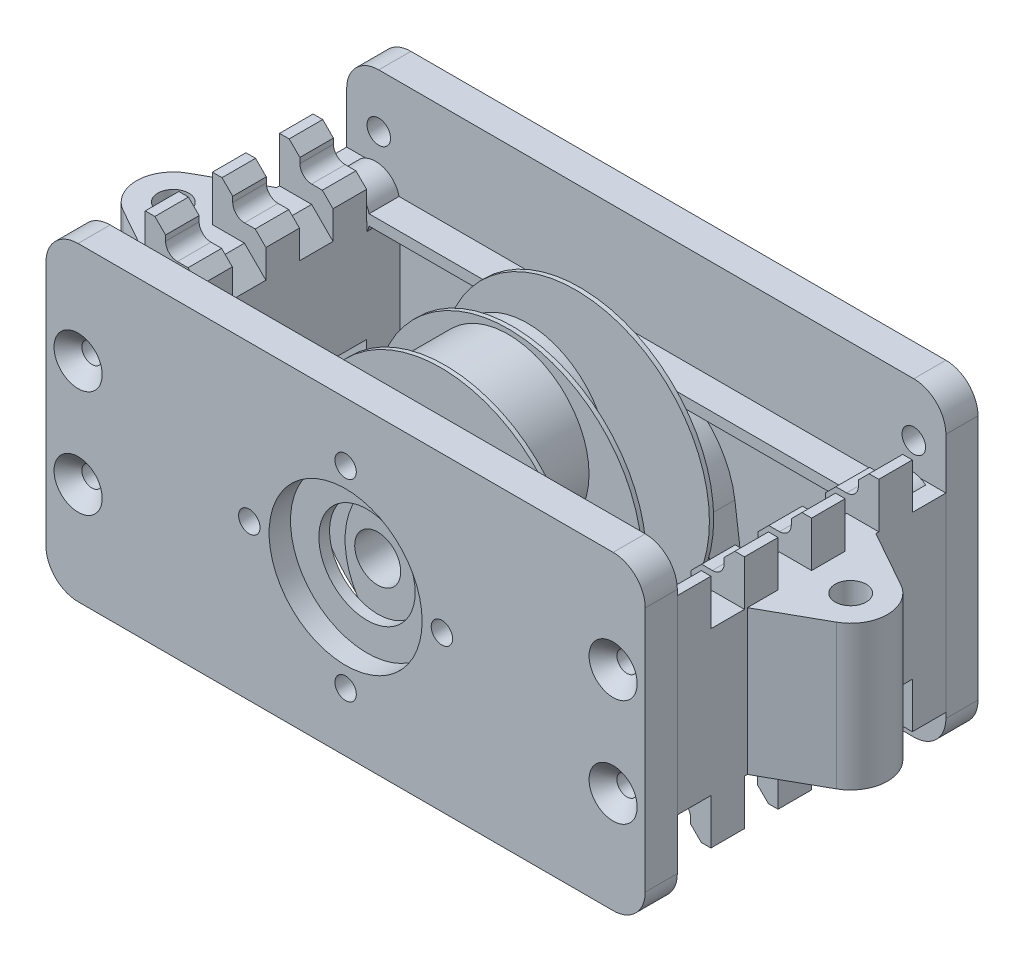
from build123d import *
from build123d.topology import SkipClean

# Parameters (mm, degrees)
SKETCH3_R                        = 8.65
SKETCH3_R_2                      = 7.65
SKETCH3_R_3                      = 2.25
SKETCH3_R_4                      = 1.25
BOSS_EXTRUDE1_DEPTH              = 2.8
BOSS_EXTRUDE2_DEPTH              = 2
BOSS_EXTRUDE3_DEPTH              = 3
BOSS_EXTRUDE4_START              = 2
BOSS_EXTRUDE4_DEPTH              = 1
FILLET1_R                        = 1
SKETCH4_R                        = 2
CUT_EXTRUDE1_DEPTH               = 36.881541288
CIRPATTERN1_COUNT                = 4
CIRPATTERN1_ANGLE                = 23
CIRPATTERN1_THE_OTHER_WAY_COUNT  = 4
CIRPATTERN1_THE_OTHER_WAY_ANGLE  = 23
BOSS_EXTRUDE5_START              = -0.3
SKETCH5_W                        = 56
SKETCH5_H                        = 29
SKETCH5_R                        = 1.1
SKETCH5_R_2                      = 0.95
BOSS_EXTRUDE5_DEPTH              = 3
BOSS_EXTRUDE6_START              = -3.3
SKETCH5_2_R                      = 1.1
BOSS_EXTRUDE6_DEPTH              = 0.8
BOSS_EXTRUDE7_OUTLINE_R          = 7.55
BOSS_EXTRUDE7_DEPTH              = 5.9
BOSS_EXTRUDE8_START              = 5.9
SKETCH6_4_R                      = 12.5
SKETCH6_4_R_2                    = 2.15
BOSS_EXTRUDE8_DEPTH              = 0.4
BOSS_EXTRUDE9_START              = 6.3
BOSS_EXTRUDE9_OUTLINE_R          = 7.55
BOSS_EXTRUDE9_DEPTH              = 5.9
BOSS_EXTRUDE10_START             = 12.2
SKETCH6_6_R                      = 12.5
SKETCH6_6_R_2                    = 2.15
BOSS_EXTRUDE10_DEPTH             = 0.4
BOSS_EXTRUDE11_START             = 12.6
BOSS_EXTRUDE11_OUTLINE_R         = 7.55
BOSS_EXTRUDE11_DEPTH             = 5.9
BOSS_EXTRUDE12_START             = 18.5
SKETCH6_8_R                      = 12.5
SKETCH6_8_R_2                    = 2.15
BOSS_EXTRUDE12_DEPTH             = 0.4
BOSS_EXTRUDE13_START             = 18.9
BOSS_EXTRUDE13_OUTLINE_R         = 7.55
BOSS_EXTRUDE13_DEPTH             = 5.9
SKETCH7_W                        = 3.1375
SKETCH7_H                        = 13.5
SKETCH7_H_2                      = 4.25
BOSS_EXTRUDE14_DEPTH             = 5
BOSS_EXTRUDE15_REACH             = 47.714
SKETCH8_R                        = 1.45
BOSS_EXTRUDE15_DIRECTION_2_REACH = 47.714
CUT_EXTRUDE3_DEPTH               = 51.375998652
CUT_EXTRUDE8_DEPTH               = 51.375998652
CUT_EXTRUDE8_DEPTH_BACK          = 51.375998652
SKETCH5_4_R                      = 0.95
CHAMFER1_SIZE                    = 2
CHAMFER2_SIZE                    = 1
SKETCH10_3_R                     = 4.5
SKETCH10_3_R_2                   = 1
CUT_EXTRUDE5_DEPTH               = 3
CHAMFER3_SIZE                    = 1.3
SKETCH10_R                       = 7.15
SKETCH10_R_2                     = 4.5
CUT_EXTRUDE4_DEPTH               = 2
CUT_EXTRUDE6_START               = -31.1
SKETCH10_4_R                     = 4.5
CUT_EXTRUDE6_DEPTH               = 6.3
CHAMFER4_SIZE                    = 1.3
CHAMFER5_SIZE                    = 1.3
SKETCH11_R                       = 2.15
CUT_EXTRUDE7_DEPTH               = 3
FILLET2_R                        = 3
FILLET3_R                        = 3


with BuildPart() as part:
    # Sketch3 → Boss-Extrude1 (new body)
    # profile 1 of 6: a face of its own
    with BuildSketch(Plane.XY):
        with Locations((0, -4.5)):
            Circle(SKETCH3_R)
        with Locations((0, -4.5)):
            Circle(SKETCH3_R_2, mode=Mode.SUBTRACT)
    # profile 2 of 6: a face of its own
    with BuildSketch(Plane.XY):
        with BuildLine():
            Line((1, 4.5), (-1, 4.5))
            Line((-1, 4.5), (-1, 4.092002095))
            ThreePointArc((-1, 4.092002095), (0, 4.15), (1, 4.092002095))
            Line((1, 4.092002095), (1, 4.5))
        make_face()
    # profile 3 of 6: a face of its own
    with BuildSketch(Plane.XY):
        with BuildLine():
            Line((22.806258903, 5.5), (-22.806258903, 5.5))
            ThreePointArc((-22.806258903, 5.5), (-22.764108962, 5.251577555), (-22.75, 5))
            ThreePointArc((-22.75, 5), (-22.764108962, 4.748422445), (-22.806258903, 4.5))
            Line((-22.806258903, 4.5), (-1, 4.5))
            Line((-1, 4.5), (1, 4.5))
            Line((1, 4.5), (22.806258903, 4.5))
            ThreePointArc((22.806258903, 4.5), (22.75, 5), (22.806258903, 5.5))
        make_face()
    # profile 4 of 6: a face of its own
    with BuildSketch(Plane.XY):
        with Locations((25, 5)):
            Circle(SKETCH3_R_3)
        with Locations((25, 5)):
            Circle(SKETCH3_R_4, mode=Mode.SUBTRACT)
    # profile 5 of 6: a face of its own
    with BuildSketch(Plane.XY):
        with Locations((-25, 5)):
            Circle(SKETCH3_R_3)
        with Locations((-25, 5)):
            Circle(SKETCH3_R_4, mode=Mode.SUBTRACT)
    # profile 6 of 6: a face of its own
    with BuildSketch(Plane.XY):
        with BuildLine():
            ThreePointArc((8.65, -4.5), (-0.565737068, -13.131479686), (-8.575998051, -3.370948437))
            Line((-8.575998051, -3.370948437), (-10.504925398, -18.022606265))
            ThreePointArc((-10.504925398, -18.022606265), (-8.633650379, -18.732417422), (-6.714937631, -19.30166558))
            Line((-6.714937631, -19.30166558), (-7.350338345, -17.045031413))
            ThreePointArc((-7.350338345, -17.045031413), (0, -18.15), (7.350338345, -17.045031413))
            Line((7.350338345, -17.045031413), (6.714937631, -19.30166558))
            ThreePointArc((6.714937631, -19.30166558), (8.633650379, -18.732417422), (10.504925398, -18.022606265))
            Line((10.504925398, -18.022606265), (8.575998051, -3.370948437))
            ThreePointArc((8.575998051, -3.370948437), (8.631479686, -3.934262932), (8.65, -4.5))
        make_face()
    extrude(amount=BOSS_EXTRUDE1_DEPTH)

    # Sketch3<3> → Boss-Extrude2 (add)
    with SkipClean():  # the faces are left unmerged after this step: merging them gives an invalid solid
        with BuildSketch(Plane.XY):
            with BuildLine():
                Line((-6.714937631, -19.30166558), (-7.350338345, -17.045031413))
                ThreePointArc((-7.350338345, -17.045031413), (0, -18.15), (7.350338345, -17.045031413))
                Line((7.350338345, -17.045031413), (6.714937631, -19.30166558))
                ThreePointArc((6.714937631, -19.30166558), (0, -20.15), (-6.714937631, -19.30166558))
            make_face()
        extrude(amount=BOSS_EXTRUDE2_DEPTH)


with BuildPart() as body_2:
    # Sketch3<4> → Boss-Extrude3 (new body)
    with BuildSketch(Plane.XY):
        with BuildLine():
            ThreePointArc((-6.714937631, -19.30166558), (-8.633650379, -18.732417422), (-10.504925398, -18.022606265))
            Line((-10.504925398, -18.022606265), (-10.909551865, -21.096049419))
            ThreePointArc((-10.909551865, -21.096049419), (0, -23.15), (10.909551865, -21.096049419))
            Line((10.909551865, -21.096049419), (10.504925398, -18.022606265))
            ThreePointArc((10.504925398, -18.022606265), (8.633650379, -18.732417422), (6.714937631, -19.30166558))
            ThreePointArc((6.714937631, -19.30166558), (0, -20.15), (-6.714937631, -19.30166558))
        make_face()
    extrude(amount=BOSS_EXTRUDE3_DEPTH)

    # Sketch3<5> → Boss-Extrude4 (add)
    with BuildSketch(Plane.XY.offset(BOSS_EXTRUDE4_START)):
        with BuildLine():
            Line((-6.714937631, -19.30166558), (-7.350338345, -17.045031413))
            ThreePointArc((-7.350338345, -17.045031413), (0, -18.15), (7.350338345, -17.045031413))
            Line((7.350338345, -17.045031413), (6.714937631, -19.30166558))
            ThreePointArc((6.714937631, -19.30166558), (0, -20.15), (-6.714937631, -19.30166558))
        make_face()
    extrude(amount=BOSS_EXTRUDE4_DEPTH)

    # Fillet1
    fillet1_edges = [body_2.edges().sort_by_distance(p)[0] for p in [
        (0, -23.15, 3),
        (0, -23.15, 0),
    ]]
    fillet(fillet1_edges, radius=FILLET1_R)

    # Sketch4 → Cut-Extrude1 (cut, symmetric)
    with BuildSketch(Plane.XY):
        with Locations((0, -23.35)):
            Circle(SKETCH4_R)
    cut_extrude1 = extrude(amount=CUT_EXTRUDE1_DEPTH, both=True, mode=Mode.SUBTRACT)

    # CirPattern1: Cut-Extrude1 ×4 about axis
    cirpattern1_axis = Axis((0, 6.85, 0), (0, 0, 1))
    for i in range(1, CIRPATTERN1_COUNT):
        add(cut_extrude1.rotate(cirpattern1_axis, i * CIRPATTERN1_ANGLE / (CIRPATTERN1_COUNT - 1)), mode=Mode.SUBTRACT)

    # CirPattern1 the other way: Cut-Extrude1 ×4 about axis
    cirpattern1_the_other_way_axis = Axis((0, 6.85, 0), (0, 0, -1))
    for i in range(1, CIRPATTERN1_THE_OTHER_WAY_COUNT):
        add(cut_extrude1.rotate(cirpattern1_the_other_way_axis, i * CIRPATTERN1_THE_OTHER_WAY_ANGLE / (CIRPATTERN1_THE_OTHER_WAY_COUNT - 1)), mode=Mode.SUBTRACT)


with BuildPart() as body_3:
    # Sketch5 → Boss-Extrude5 (new body)
    with BuildSketch(Plane.XY.offset(BOSS_EXTRUDE5_START)):
        Rectangle(SKETCH5_W, SKETCH5_H)
        with Locations((-25, 9.5)):
            Circle(SKETCH5_R, mode=Mode.SUBTRACT)
        with Locations((25, 9.5)):
            Circle(SKETCH5_R, mode=Mode.SUBTRACT)
        with Locations(Location((25, -9.5, 0), (0, 0, 180))):
            Circle(SKETCH5_R, mode=Mode.SUBTRACT)
        with Locations(Location((-25, -9.5, 0), (0, 0, 180))):
            Circle(SKETCH5_R, mode=Mode.SUBTRACT)
        with Locations((-25, 5)):
            Circle(SKETCH5_R_2, mode=Mode.SUBTRACT)
        with Locations((-25, -5)):
            Circle(SKETCH5_R_2, mode=Mode.SUBTRACT)
        with Locations(Location((25, -5, 0), (0, 0, 180))):
            Circle(SKETCH5_R_2, mode=Mode.SUBTRACT)
        with Locations(Location((25, 5, 0), (0, 0, 180))):
            Circle(SKETCH5_R_2, mode=Mode.SUBTRACT)
    extrude(amount=-BOSS_EXTRUDE5_DEPTH)

    # Sketch5<2> → Boss-Extrude6 (add)
    with BuildSketch(Plane.XY.offset(BOSS_EXTRUDE6_START)):
        with Locations((-25, 9.5)):
            Circle(SKETCH5_2_R)
        with Locations(Location((-25, -9.5, 0), (0, 0, 180))):
            Circle(SKETCH5_2_R)
        with Locations((25, 9.5)):
            Circle(SKETCH5_2_R)
        with Locations(Location((25, -9.5, 0), (0, 0, 180))):
            Circle(SKETCH5_2_R)
    extrude(amount=BOSS_EXTRUDE6_DEPTH)


with BuildPart() as body_4:
    # Boss-Extrude7: read off the stored shape, not the designer's step
    # Boss-Extrude7 outline → Boss-Extrude7 (new body)
    with BuildSketch(Plane.XY):
        with Locations((0, -4.5)):
            Circle(BOSS_EXTRUDE7_OUTLINE_R)
        with BuildLine():
            Line((-1.489966443, 1.55), (1.489966443, 1.55))
            ThreePointArc((1.489966443, 1.55), (0, -2.15), (-1.489966443, 1.55))
        make_face(mode=Mode.SUBTRACT)
    extrude(amount=BOSS_EXTRUDE7_DEPTH)


with BuildPart() as body_5:
    # Sketch6<4> → Boss-Extrude8 (new body)
    with BuildSketch(Plane.XY.offset(BOSS_EXTRUDE8_START)):
        Circle(SKETCH6_4_R)
        Circle(SKETCH6_4_R_2, mode=Mode.SUBTRACT)
    extrude(amount=BOSS_EXTRUDE8_DEPTH)


with BuildPart() as body_6:
    # Boss-Extrude9: read off the stored shape, not the designer's step
    # Boss-Extrude9 outline → Boss-Extrude9 (new body)
    with BuildSketch(Plane.XY.offset(BOSS_EXTRUDE9_START)):
        with Locations((-4.5, 0)):
            Circle(BOSS_EXTRUDE9_OUTLINE_R)
        with BuildLine():
            Line((-1.489966443, 1.55), (1.489966443, 1.55))
            ThreePointArc((1.489966443, 1.55), (0, -2.15), (-1.489966443, 1.55))
        make_face(mode=Mode.SUBTRACT)
    extrude(amount=BOSS_EXTRUDE9_DEPTH)


with BuildPart() as body_7:
    # Sketch6<6> → Boss-Extrude10 (new body)
    with BuildSketch(Plane.XY.offset(BOSS_EXTRUDE10_START)):
        Circle(SKETCH6_6_R)
        Circle(SKETCH6_6_R_2, mode=Mode.SUBTRACT)
    extrude(amount=BOSS_EXTRUDE10_DEPTH)


with BuildPart() as body_8:
    # Boss-Extrude11: read off the stored shape, not the designer's step
    # Boss-Extrude11 outline → Boss-Extrude11 (new body)
    with BuildSketch(Plane.XY.offset(BOSS_EXTRUDE11_START)):
        with Locations((0, 4.5)):
            Circle(BOSS_EXTRUDE11_OUTLINE_R)
        with BuildLine():
            Line((-1.489966443, 1.55), (1.489966443, 1.55))
            ThreePointArc((1.489966443, 1.55), (0, -2.15), (-1.489966443, 1.55))
        make_face(mode=Mode.SUBTRACT)
    extrude(amount=BOSS_EXTRUDE11_DEPTH)


with BuildPart() as body_9:
    # Sketch6<8> → Boss-Extrude12 (new body)
    with BuildSketch(Plane.XY.offset(BOSS_EXTRUDE12_START)):
        Circle(SKETCH6_8_R)
        Circle(SKETCH6_8_R_2, mode=Mode.SUBTRACT)
    extrude(amount=BOSS_EXTRUDE12_DEPTH)


with BuildPart() as body_10:
    # Boss-Extrude13: read off the stored shape, not the designer's step
    # Boss-Extrude13 outline → Boss-Extrude13 (new body)
    with BuildSketch(Plane.XY.offset(BOSS_EXTRUDE13_START)):
        with Locations((4.5, 0)):
            Circle(BOSS_EXTRUDE13_OUTLINE_R)
        with BuildLine():
            Line((-1.489966443, 1.55), (1.489966443, 1.55))
            ThreePointArc((1.489966443, 1.55), (0, -2.15), (-1.489966443, 1.55))
        make_face(mode=Mode.SUBTRACT)
    extrude(amount=BOSS_EXTRUDE13_DEPTH)

    # Sketch11 → Cut-Extrude7 (cut)
    with BuildSketch(Plane.XY.offset(24.8)):
        with Locations(Location((0, 0, 0), (0, 0, 133.868664343))):
            Circle(SKETCH11_R)
    extrude(amount=-CUT_EXTRUDE7_DEPTH, mode=Mode.SUBTRACT)


with BuildPart() as body_11:
    # Mirror1: mirrored copy
    add(body_3.part.mirror(Plane.XY.offset(12.25)))

    # Sketch10<3> → Cut-Extrude5 (cut)
    with BuildSketch(Plane.XY.offset(27.8)):
        Circle(SKETCH10_3_R)
        with Locations((-9, 0)):
            Circle(SKETCH10_3_R_2)
        with Locations((0, 9)):
            Circle(SKETCH10_3_R_2)
        with Locations((9, 0)):
            Circle(SKETCH10_3_R_2)
        with Locations((0, -9)):
            Circle(SKETCH10_3_R_2)
    extrude(amount=-CUT_EXTRUDE5_DEPTH, mode=Mode.SUBTRACT)

    # Chamfer3
    chamfer3_edges = [body_11.edges().sort_by_distance(p)[0] for p in [
        (-10, 0, 24.8),
        (-1, 9, 24.8),
        (8, 0, 24.8),
        (-1, -9, 24.8),
    ]]
    chamfer(chamfer3_edges, length=CHAMFER3_SIZE)

    # Sketch10 → Cut-Extrude4 (cut)
    with BuildSketch(Plane.XY.offset(27.8)):
        Circle(SKETCH10_R)
        Circle(SKETCH10_R_2, mode=Mode.SUBTRACT)
    extrude(amount=-CUT_EXTRUDE4_DEPTH, mode=Mode.SUBTRACT)

    # Chamfer5
    chamfer5_edges = [body_11.edges().sort_by_distance(p)[0] for p in [
        (-25.95, 5, 27.8),
        (-25.95, -5, 27.8),
        (25.95, -5, 27.8),
        (25.95, 5, 27.8),
    ]]
    chamfer(chamfer5_edges, length=CHAMFER5_SIZE)

    # Fillet2
    fillet2_edges = [body_11.edges().sort_by_distance(p)[0] for p in [
        (28, 14.5, 26.3),
        (28, -14.5, 26.3),
        (-28, -14.5, 26.3),
        (-28, 14.5, 26.3),
    ]]
    fillet(fillet2_edges, radius=FILLET2_R)


with BuildPart() as body_12:
    # Sketch7 → Boss-Extrude14 (new body)
    with BuildSketch(Plane(origin=(28, 0, 0), x_dir=(0, 0, -1), z_dir=(1, 0, 0))):
        with Locations((-1.26875, 0)):
            Rectangle(SKETCH7_W, SKETCH7_H)
        with Locations((-4.40625, 0)):
            Rectangle(SKETCH7_W, SKETCH7_H)
        with Locations((-7.54375, 0)):
            Rectangle(SKETCH7_W, SKETCH7_H)
        with Locations((-10.68125, 0)):
            Rectangle(SKETCH7_W, SKETCH7_H)
        with Locations((-13.81875, 0)):
            Rectangle(SKETCH7_W, SKETCH7_H)
        with Locations((-16.95625, 0)):
            Rectangle(SKETCH7_W, SKETCH7_H)
        with Locations((-20.09375, 0)):
            Rectangle(SKETCH7_W, SKETCH7_H)
        with Locations((-23.23125, 0)):
            Rectangle(SKETCH7_W, SKETCH7_H)
        with Locations((-4.40625, 8.875)):
            Rectangle(SKETCH7_W, SKETCH7_H_2)
        with Locations((-1.26875, -8.875)):
            Rectangle(SKETCH7_W, SKETCH7_H_2)
        with Locations((-7.54375, -8.875)):
            Rectangle(SKETCH7_W, SKETCH7_H_2)
        with Locations((-10.68125, 8.875)):
            Rectangle(SKETCH7_W, SKETCH7_H_2)
        with Locations((-13.81875, -8.875)):
            Rectangle(SKETCH7_W, SKETCH7_H_2)
        with Locations((-20.09375, -8.875)):
            Rectangle(SKETCH7_W, SKETCH7_H_2)
        with Locations((-16.95625, 8.875)):
            Rectangle(SKETCH7_W, SKETCH7_H_2)
        with Locations((-23.23125, 8.875)):
            Rectangle(SKETCH7_W, SKETCH7_H_2)
    extrude(amount=-BOSS_EXTRUDE14_DEPTH)

    # Boss-Extrude15: up to this face of the body (flat: up to its plane)
    boss_extrude15_end = Plane(body_12.part.faces().sort_by_distance((25.5, 6.75, 7.54375))[0])
    # Sketch8 → Boss-Extrude15 (add, up to the picked face)
    with BuildSketch(Plane(origin=(0, 0, 0), x_dir=(1, 0, 0), z_dir=(0, 1, 0)), mode=Mode.PRIVATE) as boss_extrude15_sk1:
        with BuildLine():
            Line((33.336485583, -9.240304604), (28, -6.25))
            Line((28, -6.25), (28, -18.25))
            Line((28, -18.25), (33.336485583, -15.259695396))
            ThreePointArc((33.336485583, -15.259695396), (35.1, -12.25), (33.336485583, -9.240304604))
        make_face()
        with Locations(Location((31.65, -12.25, 0), (0, 0, 90))):
            Circle(SKETCH8_R, mode=Mode.SUBTRACT)
    boss_extrude15_tool1 = split(extrude(boss_extrude15_sk1.sketch, amount=BOSS_EXTRUDE15_REACH, mode=Mode.PRIVATE), bisect_by=boss_extrude15_end, keep=Keep.BOTH, mode=Mode.PRIVATE)
    add(boss_extrude15_tool1.solids().sort_by(Axis((30.600084, 0, 7.866788), (0, 1, 0)))[0])

    # Boss-Extrude15 direction 2: up to this face of the body (flat: up to its plane)
    boss_extrude15_direction_2_end = Plane(body_12.part.faces().sort_by_distance((25.5, -6.75, 4.40625))[0])
    # Sketch8 → Boss-Extrude15 direction 2 (add, up to the picked face)
    with BuildSketch(Plane(origin=(0, 0, 0), x_dir=(1, 0, 0), z_dir=(0, 1, 0)), mode=Mode.PRIVATE) as boss_extrude15_direction_2_sk1:
        with BuildLine():
            Line((33.336485583, -9.240304604), (28, -6.25))
            Line((28, -6.25), (28, -18.25))
            Line((28, -18.25), (33.336485583, -15.259695396))
            ThreePointArc((33.336485583, -15.259695396), (35.1, -12.25), (33.336485583, -9.240304604))
        make_face()
        with Locations(Location((31.65, -12.25, 0), (0, 0, 90))):
            Circle(SKETCH8_R, mode=Mode.SUBTRACT)
    boss_extrude15_direction_2_tool1 = split(extrude(boss_extrude15_direction_2_sk1.sketch, amount=-BOSS_EXTRUDE15_DIRECTION_2_REACH, mode=Mode.PRIVATE), bisect_by=boss_extrude15_direction_2_end, keep=Keep.BOTH, mode=Mode.PRIVATE)
    add(boss_extrude15_direction_2_tool1.solids().sort_by(Axis((30.600084, 0, 7.866788), (0, -1, 0)))[0])

    # Sketch9 → Cut-Extrude3 (cut, through all)
    with BuildSketch(Plane.XY):
        with BuildLine():
            Line((26.1, 9.5), (26.1, 11))
            Line((26.1, 11), (23, 11))
            Line((23, 11), (23, 8.4))
            Line((23, 8.4), (25, 8.4))
            ThreePointArc((25, 8.4), (25.777817459, 8.722182541), (26.1, 9.5))
        make_face()
        with BuildLine():
            Line((23, -8.4), (25, -8.4))
            ThreePointArc((25, -8.4), (25.777817459, -8.722182541), (26.1, -9.5))
            Line((26.1, -9.5), (26.1, -11))
            Line((26.1, -11), (23, -11))
            Line((23, -11), (23, -8.4))
        make_face()
    extrude(amount=CUT_EXTRUDE3_DEPTH, mode=Mode.SUBTRACT)

    # Sketch5<4> → Cut-Extrude8 (cut, two sides: drawn at the far end of the back side and taken through both)
    with BuildSketch(Plane.XY.offset(-CUT_EXTRUDE8_DEPTH_BACK)):
        with Locations(Location((25, -5, 0), (0, 0, 270))):
            Circle(SKETCH5_4_R)
        with Locations(Location((25, 5, 0), (0, 0, 270))):
            Circle(SKETCH5_4_R)
    extrude(amount=CUT_EXTRUDE8_DEPTH + CUT_EXTRUDE8_DEPTH_BACK, mode=Mode.SUBTRACT)

    # Chamfer1
    chamfer1_edges = [body_12.edges().sort_by_distance(p)[0] for p in [
        (23, -6.75, 16.95625),
        (23, -6.75, 10.68125),
        (23, -6.75, 4.40625),
        (23, 6.75, 7.54375),
        (23, 6.75, 13.81875),
        (23, 6.75, 1.26875),
        (23, 6.75, 20.09375),
        (23, -6.75, 23.23125),
    ]]
    chamfer(chamfer1_edges, length=CHAMFER1_SIZE)

    # Chamfer2
    chamfer2_edges = [body_12.edges().sort_by_distance(p)[0] for p in [
        (23, -8.4, 7.54375),
        (23, -8.4, 13.81875),
        (23, -8.4, 20.09375),
        (23, 8.4, 23.23125),
        (23, 8.4, 16.95625),
        (23, 8.4, 10.68125),
        (23, 8.4, 4.40625),
        (26.1, 11, 23.23125),
        (26.1, 11, 16.95625),
        (26.1, 11, 10.68125),
        (26.1, 11, 4.40625),
        (26.1, -11, 7.54375),
        (26.1, -11, 13.81875),
        (26.1, -11, 20.09375),
    ]]
    chamfer(chamfer2_edges, length=CHAMFER2_SIZE)


with BuildPart() as body_13:
    # Mirror2: mirrored copy
    add(body_12.part.mirror(Plane(origin=(0, 0, 0), x_dir=(0, 0, 1), z_dir=(1, 0, 0))))


with BuildPart() as body_3_1:
    add(body_3.part)

    # Sketch10<4> → Cut-Extrude6 (cut)
    with BuildSketch(Plane.XY.offset(27.8).offset(CUT_EXTRUDE6_START)):
        Circle(SKETCH10_4_R)
    extrude(amount=CUT_EXTRUDE6_DEPTH, mode=Mode.SUBTRACT)

    # Chamfer4
    chamfer4_edges = [body_3_1.edges().sort_by_distance(p)[0] for p in [
        (-25.95, 5, -3.3),
        (-25.95, -5, -3.3),
        (25.95, -5, -3.3),
        (25.95, 5, -3.3),
    ]]
    chamfer(chamfer4_edges, length=CHAMFER4_SIZE)

    # Fillet3
    fillet3_edges = [body_3_1.edges().sort_by_distance(p)[0] for p in [
        (28, 14.5, -1.8),
        (28, -14.5, -1.8),
        (-28, -14.5, -1.8),
        (-28, 14.5, -1.8),
    ]]
    fillet(fillet3_edges, radius=FILLET3_R)


solid = Compound([part.part, body_2.part, body_4.part, body_5.part, body_6.part, body_7.part, body_8.part, body_9.part, body_10.part, body_11.part, body_12.part, body_13.part, body_3_1.part])
